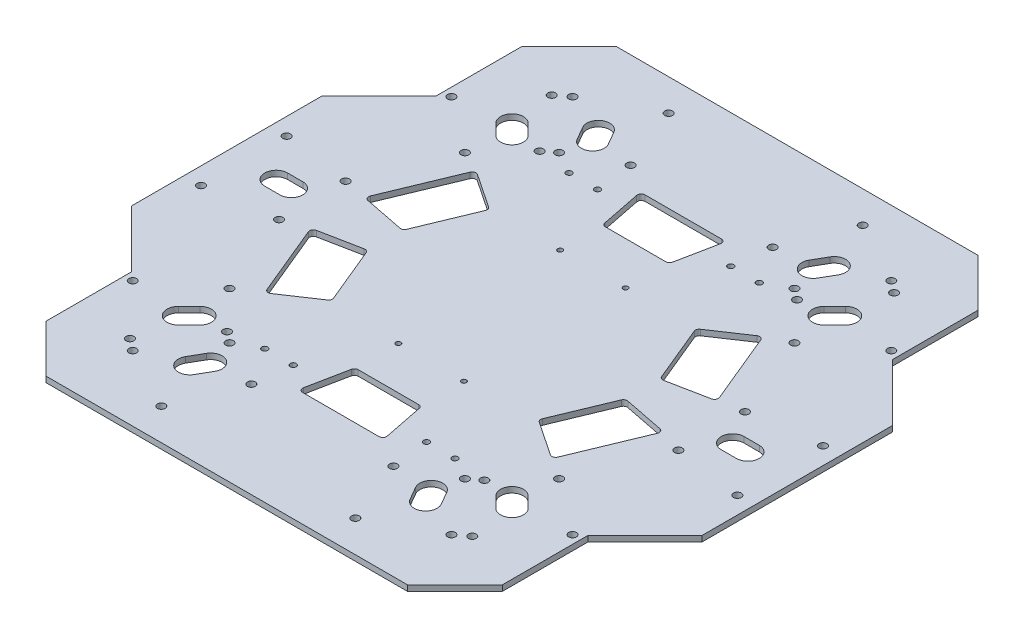
from build123d import *

# Parameters (mm, degrees)
BOSS_EXTRUDE1_DEPTH    = 3
SKETCH2_R              = 2.05
HEXCUT1_DEPTH          = 3
SKETCH5_R              = 1.55
CUT_EXTRUDE2_DEPTH     = 3
LPATTERN1_COUNT        = 2
LPATTERN1_PITCH        = 160
LPATTERN1_COUNT_DIR2   = 2
LPATTERN1_PITCH_DIR2   = 85
SKETCH6_R              = 2.05
QUADCUT1_DEPTH         = 3
SKETCH7_R              = 1.3
STDCARRIERCUBEFP_DEPTH = 3
CUT_EXTRUDE3_DEPTH     = 3
FILLET1_R              = 2
CIRPATTERN1_DEPTH      = 3
FILLET1_OF_MIRROR1_R   = 2
CUT_EXTRUDE4_DEPTH     = 3


# Read off the part's stored shape, not the designer's step: CirPattern1
with BuildPart() as part:
    # Sketch1 → Boss-Extrude1 (new body)
    with BuildSketch(Plane(origin=(0, 0, 0), x_dir=(1, 0, 0), z_dir=(0, 1, 0))):
        Polygon((-95, 150), (-120, 125), (-120, 80), (-150, 50), (-150, -50), (-120, -80), (-120, -125), (-95, -150), (95, -150), (120, -125), (120, -80), (150, -50), (150, 50), (120, 80), (120, 125), (95, 150), align=None)
    extrude(amount=BOSS_EXTRUDE1_DEPTH)

    # Sketch2 → HexCut1 (cut)
    with BuildSketch(Plane(origin=(0, 3, 0), x_dir=(1, 0, 0), z_dir=(0, 1, 0))):
        with Locations(Location((51.014428415, 133.359581934, 0), (0, 0, 270))):
            Circle(SKETCH2_R)
        with Locations(Location((37.344555434, 99.682667397, 0), (0, 0, 270))):
            Circle(SKETCH2_R)
        with Locations(Location((37.344555434, -99.682667397, 0), (0, 0, 270))):
            Circle(SKETCH2_R)
        with Locations(Location((51.014428415, -133.359581934, 0), (0, 0, 270))):
            Circle(SKETCH2_R)
        with Locations(Location((105, 17.5, 0), (0, 0, 270))):
            Circle(SKETCH2_R)
        with Locations(Location((141, 22.5, 0), (0, 0, 270))):
            Circle(SKETCH2_R)
        with Locations(Location((105, -17.5, 0), (0, 0, 270))):
            Circle(SKETCH2_R)
        with Locations(Location((141, -22.5, 0), (0, 0, 270))):
            Circle(SKETCH2_R)
        with Locations(Location((89.985571585, -110.859581934, 0), (0, 0, 270))):
            Circle(SKETCH2_R)
        with Locations(Location((67.655444566, -82.182667397, 0), (0, 0, 270))):
            Circle(SKETCH2_R)
        with Locations(Location((89.985571585, 110.859581934, 0), (0, 0, 270))):
            Circle(SKETCH2_R)
        with Locations(Location((67.655444566, 82.182667397, 0), (0, 0, 270))):
            Circle(SKETCH2_R)
    hexcut1 = extrude(amount=-HEXCUT1_DEPTH, mode=Mode.SUBTRACT)

    # HexCut2: HexCut1 across plane
    add(hexcut1.mirror(Plane(origin=(0, 0, 0), x_dir=(0, 0, 1), z_dir=(1, 0, 0))), mode=Mode.SUBTRACT)

    # Sketch5 → Cut-Extrude2 (cut)
    with BuildSketch(Plane(origin=(0, 3, 0), x_dir=(1, 0, 0), z_dir=(0, 1, 0))):
        with Locations(Location((35, 80, 0), (0, 0, 270))):
            Circle(SKETCH5_R)
        with Locations(Location((50, 80, 0), (0, 0, 270))):
            Circle(SKETCH5_R)
    cut_extrude2 = extrude(amount=-CUT_EXTRUDE2_DEPTH, mode=Mode.SUBTRACT)

    # LPattern1: Cut-Extrude2 2 × 2
    with Locations(*[(-j * LPATTERN1_PITCH_DIR2, 0, i * LPATTERN1_PITCH) for i in range(LPATTERN1_COUNT) for j in range(LPATTERN1_COUNT_DIR2) if (i, j) != (0, 0)]):
        add(cut_extrude2, mode=Mode.SUBTRACT)

    # Sketch6 → QuadCut1 (cut)
    with BuildSketch(Plane(origin=(0, 3, 0), x_dir=(1, 0, 0), z_dir=(0, 1, 0))):
        with Locations(Location((86.620580695, 61.871843354, 0), (0, 0, 270))):
            Circle(SKETCH6_R)
        with Locations(Location((115.611958724, 83.792153571, 0), (0, 0, 270))):
            Circle(SKETCH6_R)
        with Locations(Location((83.792153571, 115.611958724, 0), (0, 0, 270))):
            Circle(SKETCH6_R)
        with Locations(Location((61.871843354, 86.620580695, 0), (0, 0, 270))):
            Circle(SKETCH6_R)
        with Locations(Location((86.620580695, -61.871843354, 0), (0, 0, 270))):
            Circle(SKETCH6_R)
        with Locations(Location((61.871843354, -86.620580695, 0), (0, 0, 270))):
            Circle(SKETCH6_R)
        with Locations(Location((83.792153571, -115.611958724, 0), (0, 0, 270))):
            Circle(SKETCH6_R)
        with Locations(Location((115.611958724, -83.792153571, 0), (0, 0, 270))):
            Circle(SKETCH6_R)
    quadcut1 = extrude(amount=-QUADCUT1_DEPTH, mode=Mode.SUBTRACT)

    # QuadCut2: QuadCut1 across plane
    add(quadcut1.mirror(Plane(origin=(0, 0, 0), x_dir=(0, 0, 1), z_dir=(1, 0, 0))), mode=Mode.SUBTRACT)

    # Sketch7 → StdCarrierCubeFP (cut)
    with BuildSketch(Plane(origin=(0, 3, 0), x_dir=(1, 0, 0), z_dir=(0, 1, 0))):
        with Locations(Location((-17.2, 42.5, 0), (0, 0, 270))):
            Circle(SKETCH7_R)
        with Locations(Location((17.2, 42.5, 0), (0, 0, 270))):
            Circle(SKETCH7_R)
        with Locations(Location((-17.2, -42.5, 0), (0, 0, 270))):
            Circle(SKETCH7_R)
        with Locations(Location((17.2, -42.5, 0), (0, 0, 270))):
            Circle(SKETCH7_R)
    extrude(amount=-STDCARRIERCUBEFP_DEPTH, mode=Mode.SUBTRACT)

    # Sketch8 → Cut-Extrude3 (cut)
    with BuildSketch(Plane(origin=(0, 3, 0), x_dir=(1, 0, 0), z_dir=(0, 1, 0))):
        Polygon((-17.5, -65), (17.5, -65), (22.5, -90), (-22.5, -90), align=None)
    cut_extrude3 = extrude(amount=-CUT_EXTRUDE3_DEPTH, mode=Mode.SUBTRACT)

    # Fillet1
    fillet1_edges = [part.edges().sort_by_distance(p)[0] for p in [
        (-22.5, 1.5, 90),
        (-17.5, 1.5, 65),
        (17.5, 1.5, 65),
        (22.5, 1.5, 90),
    ]]
    fillet(fillet1_edges, radius=FILLET1_R)

    # CirPattern1 outline → CirPattern1 (cut)
    with BuildSketch(Plane(origin=(0, 0, 0), x_dir=(1, 0, 0), z_dir=(0, 1, 0))):
        with BuildLine():
            ThreePointArc((54.915749171, -38.904044772), (54.849324183, -40.248979934), (55.650628912, -41.331187678))
            Line((55.650628912, -41.331187678), (73.444828679, -53.247833794))
            ThreePointArc((73.444828679, -53.247833794), (75.1372763, -53.500241806), (76.405467068, -52.351424618))
            Line((76.405467068, -52.351424618), (91.759026547, -15.284653092))
            ThreePointArc((91.759026547, -15.284653092), (91.67461668, -13.575570376), (90.299396073, -12.557308603))
            Line((90.299396073, -12.557308603), (69.290655474, -8.40125056))
            ThreePointArc((69.290655474, -8.40125056), (67.958811033, -8.599878987), (67.054767819, -9.59786132))
            Line((67.054767819, -9.59786132), (54.915749171, -38.904044772))
        make_face()
        with BuildLine():
            ThreePointArc((67.054767819, 11.617797575), (67.958811032, 10.619815242), (69.290655474, 10.421186816))
            Line((69.290655474, 10.421186816), (90.299396073, 14.577244859))
            ThreePointArc((90.299396073, 14.577244859), (91.67461668, 15.595506632), (91.759026547, 17.304589348))
            Line((91.759026547, 17.304589348), (76.405467068, 54.371360873))
            ThreePointArc((76.405467068, 54.371360873), (75.1372763, 55.520178061), (73.444828679, 55.267770049))
            Line((73.444828679, 55.267770049), (55.650628912, 43.351123933))
            ThreePointArc((55.650628912, 43.351123933), (54.849324183, 42.268916189), (54.915749171, 40.923981027))
            Line((54.915749171, 40.923981027), (67.054767819, 11.617797575))
        make_face()
        with BuildLine():
            ThreePointArc((-54.915749171, 40.923981027), (-54.849324183, 42.268916189), (-55.650628912, 43.351123933))
            Line((-55.650628912, 43.351123933), (-73.444828679, 55.267770049))
            ThreePointArc((-73.444828679, 55.267770049), (-75.1372763, 55.520178061), (-76.405467068, 54.371360873))
            Line((-76.405467068, 54.371360873), (-91.759026547, 17.304589348))
            ThreePointArc((-91.759026547, 17.304589348), (-91.67461668, 15.595506632), (-90.299396073, 14.577244859))
            Line((-90.299396073, 14.577244859), (-69.290655474, 10.421186816))
            ThreePointArc((-69.290655474, 10.421186816), (-67.958811032, 10.619815242), (-67.054767819, 11.617797575))
            Line((-67.054767819, 11.617797575), (-54.915749171, 40.923981027))
        make_face()
        with BuildLine():
            ThreePointArc((-67.054767819, -9.59786132), (-67.958811033, -8.599878987), (-69.290655474, -8.40125056))
            Line((-69.290655474, -8.40125056), (-90.299396073, -12.557308603))
            ThreePointArc((-90.299396073, -12.557308603), (-91.67461668, -13.575570376), (-91.759026547, -15.284653092))
            Line((-91.759026547, -15.284653092), (-76.405467068, -52.351424618))
            ThreePointArc((-76.405467068, -52.351424618), (-75.1372763, -53.500241806), (-73.444828679, -53.247833794))
            Line((-73.444828679, -53.247833794), (-55.650628912, -41.331187678))
            ThreePointArc((-55.650628912, -41.331187678), (-54.849324183, -40.248979934), (-54.915749171, -38.904044772))
            Line((-54.915749171, -38.904044772), (-67.054767819, -9.59786132))
        make_face()
    extrude(amount=CIRPATTERN1_DEPTH, mode=Mode.SUBTRACT)

    # Mirror1: Cut-Extrude3 across plane
    add(cut_extrude3.mirror(Plane.XY), mode=Mode.SUBTRACT)

    # Fillet1 of Mirror1
    fillet1_of_mirror1_edges = [part.edges().sort_by_distance(p)[0] for p in [
        (-22.5, 1.5, -90),
        (-17.5, 1.5, -65),
        (17.5, 1.5, -65),
        (22.5, 1.5, -90),
    ]]
    fillet(fillet1_of_mirror1_edges, radius=FILLET1_OF_MIRROR1_R)

    # Sketch9 → Cut-Extrude4 (cut)
    with BuildSketch(Plane(origin=(0, 3, 0), x_dir=(1, 0, 0), z_dir=(0, 1, 0))):
        with BuildLine():
            Line((63.196152423, -97.458946839), (67.196152423, -104.387150069))
            ThreePointArc((67.196152423, -104.387150069), (65, -112.583302492), (56.803847577, -110.387150069))
            Line((56.803847577, -110.387150069), (52.803847577, -103.458946839))
            ThreePointArc((52.803847577, -103.458946839), (55, -95.262794416), (63.196152423, -97.458946839))
        make_face()
        with BuildLine():
            Line((86.267027305, -77.781745931), (91.923881554, -83.43860018))
            ThreePointArc((91.923881554, -83.43860018), (91.923881554, -91.923881554), (83.43860018, -91.923881554))
            Line((83.43860018, -91.923881554), (77.781745931, -86.267027305))
            ThreePointArc((77.781745931, -86.267027305), (77.781745931, -77.781745931), (86.267027305, -77.781745931))
        make_face()
        with BuildLine():
            Line((116, 6), (124, 6))
            ThreePointArc((124, 6), (130, 0), (124, -6))
            Line((124, -6), (116, -6))
            ThreePointArc((116, -6), (110, 0), (116, 6))
        make_face()
        with BuildLine():
            Line((77.781745931, 86.267027305), (83.43860018, 91.923881554))
            ThreePointArc((83.43860018, 91.923881554), (91.923881554, 91.923881554), (91.923881554, 83.43860018))
            Line((91.923881554, 83.43860018), (86.267027305, 77.781745931))
            ThreePointArc((86.267027305, 77.781745931), (77.781745931, 77.781745931), (77.781745931, 86.267027305))
        make_face()
        with BuildLine():
            Line((52.803847577, 103.458946839), (56.803847577, 110.387150069))
            ThreePointArc((56.803847577, 110.387150069), (65, 112.583302492), (67.196152423, 104.387150069))
            Line((67.196152423, 104.387150069), (63.196152423, 97.458946839))
            ThreePointArc((63.196152423, 97.458946839), (55, 95.262794416), (52.803847577, 103.458946839))
        make_face()
        with BuildLine():
            Line((-56.803847577, 110.387150069), (-52.803847577, 103.458946839))
            ThreePointArc((-52.803847577, 103.458946839), (-55, 95.262794416), (-63.196152423, 97.458946839))
            Line((-63.196152423, 97.458946839), (-67.196152423, 104.387150069))
            ThreePointArc((-67.196152423, 104.387150069), (-65, 112.583302492), (-56.803847577, 110.387150069))
        make_face()
        with BuildLine():
            Line((-83.43860018, 91.923881554), (-77.781745931, 86.267027305))
            ThreePointArc((-77.781745931, 86.267027305), (-77.781745931, 77.781745931), (-86.267027305, 77.781745931))
            Line((-86.267027305, 77.781745931), (-91.923881554, 83.43860018))
            ThreePointArc((-91.923881554, 83.43860018), (-91.923881554, 91.923881554), (-83.43860018, 91.923881554))
        make_face()
        with BuildLine():
            Line((-124, 6), (-116, 6))
            ThreePointArc((-116, 6), (-110, 0), (-116, -6))
            Line((-116, -6), (-124, -6))
            ThreePointArc((-124, -6), (-130, 0), (-124, 6))
        make_face()
        with BuildLine():
            Line((-91.923881554, -83.43860018), (-86.267027305, -77.781745931))
            ThreePointArc((-86.267027305, -77.781745931), (-77.781745931, -77.781745931), (-77.781745931, -86.267027305))
            Line((-77.781745931, -86.267027305), (-83.43860018, -91.923881554))
            ThreePointArc((-83.43860018, -91.923881554), (-91.923881554, -91.923881554), (-91.923881554, -83.43860018))
        make_face()
        with BuildLine():
            Line((-52.803847577, -103.458946839), (-56.803847577, -110.387150069))
            ThreePointArc((-56.803847577, -110.387150069), (-65, -112.583302492), (-67.196152423, -104.387150069))
            Line((-67.196152423, -104.387150069), (-63.196152423, -97.458946839))
            ThreePointArc((-63.196152423, -97.458946839), (-55, -95.262794416), (-52.803847577, -103.458946839))
        make_face()
    extrude(amount=-CUT_EXTRUDE4_DEPTH, mode=Mode.SUBTRACT)


solid = part.part
